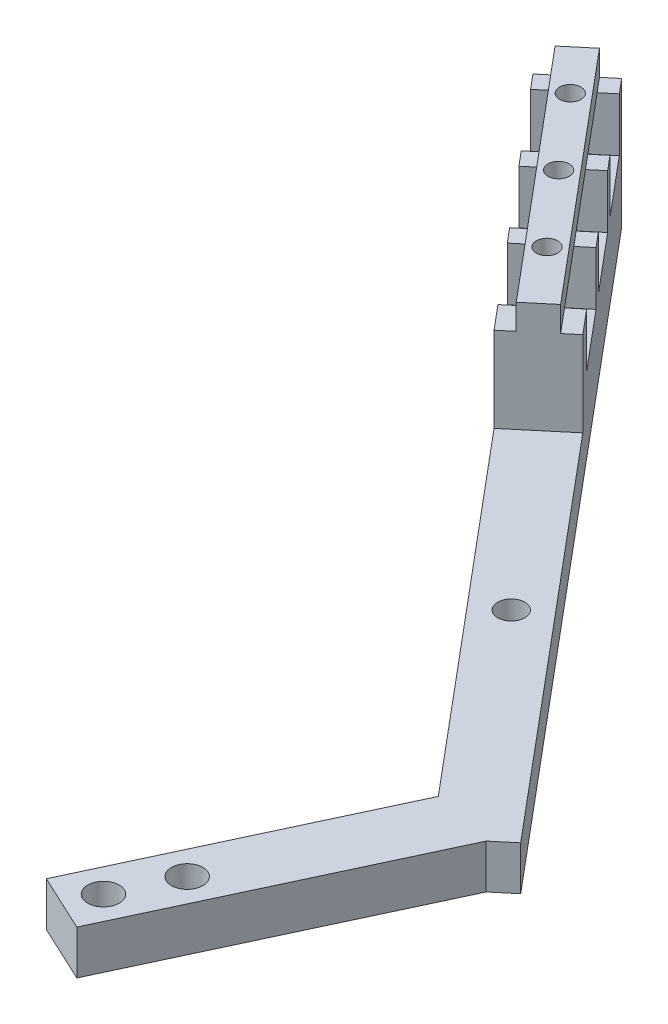
from build123d import *

# Parameters (mm, degrees)
SKETCH1_W           = 130
SKETCH1_H           = 10
SKETCH1_R           = 2.15
BOSS_EXTRUDE1_DEPTH = 7
SKETCH3_W           = 50
SKETCH3_H           = 10
BOSS_EXTRUDE2_DEPTH = 38.5
SKETCH9_W           = 10
SKETCH9_H           = 21
CUT_EXTRUDE5_DEPTH  = 139.095075944
SKETCH12_W          = 50
SKETCH12_H          = 4
CUT_EXTRUDE6_DEPTH  = 2.5
SKETCH13_W          = 50
SKETCH13_H          = 4
CUT_EXTRUDE7_DEPTH  = 2.5
SKETCH14_W          = 12
SKETCH14_H          = 8.5
CUT_EXTRUDE9_DEPTH  = 133.665933834
SKETCH15_R          = 1.7
CUT_EXTRUDE10_DEPTH = 132.98579469
BOSS_EXTRUDE4_DEPTH = 7
BOSS_EXTRUDE5_DEPTH = 7
SKETCH18_R          = 2.5
CUT_EXTRUDE11_DEPTH = 7
SKETCH19_R          = 2.5
CUT_EXTRUDE12_DEPTH = 7


with BuildPart() as part:
    # Sketch1 → Boss-Extrude1 (new body)
    with BuildSketch(Plane(origin=(0, 0, 0), x_dir=(1, 0, 0), z_dir=(0, 1, 0))):
        with Locations((65, -5)):
            Rectangle(SKETCH1_W, SKETCH1_H)
        with Locations((5, -5)):
            Circle(SKETCH1_R, mode=Mode.SUBTRACT)
        with Locations((45, -5)):
            Circle(SKETCH1_R, mode=Mode.SUBTRACT)
    extrude(amount=BOSS_EXTRUDE1_DEPTH)

    # Sketch3 → Boss-Extrude2 (add)
    with BuildSketch(Plane(origin=(0, 7, 0), x_dir=(1, 0, 0), z_dir=(0, 1, 0))):
        with Locations((105, -5)):
            Rectangle(SKETCH3_W, SKETCH3_H)
    extrude(amount=BOSS_EXTRUDE2_DEPTH)

    # Sketch9 → Cut-Extrude5 (cut, through all)
    with BuildSketch(Plane(origin=(130, 0, 0), x_dir=(0, 0, -1), z_dir=(1, 0, 0))):
        with Locations((-5, 35)):
            Rectangle(SKETCH9_W, SKETCH9_H)
    extrude(amount=-CUT_EXTRUDE5_DEPTH, mode=Mode.SUBTRACT)

    # Sketch12 → Cut-Extrude6 (cut)
    with BuildSketch(Plane.XY.offset(10)):
        with Locations((105, 22.5)):
            Rectangle(SKETCH12_W, SKETCH12_H)
    extrude(amount=-CUT_EXTRUDE6_DEPTH, mode=Mode.SUBTRACT)

    # Sketch13 → Cut-Extrude7 (cut)
    with BuildSketch(Plane(origin=(0, 0, 0), x_dir=(-1, 0, 0), z_dir=(0, 0, -1))):
        with Locations((-105, 22.5)):
            Rectangle(SKETCH13_W, SKETCH13_H)
    extrude(amount=-CUT_EXTRUDE7_DEPTH, mode=Mode.SUBTRACT)

    # Sketch14 → Cut-Extrude9 (cut, through all)
    with BuildSketch(Plane.XY.offset(10)):
        with Locations((121, 16.25)):
            Rectangle(SKETCH14_W, SKETCH14_H)
        with Locations((91, 16.25)):
            Rectangle(SKETCH14_W, SKETCH14_H)
        with Locations((106, 16.25)):
            Rectangle(SKETCH14_W, SKETCH14_H)
    extrude(amount=-CUT_EXTRUDE9_DEPTH, mode=Mode.SUBTRACT)

    # Sketch15 → Cut-Extrude10 (cut, through all)
    with BuildSketch(Plane(origin=(0, 20.5, 0), x_dir=(-1, 0, 0), z_dir=(0, -1, 0))):
        with Locations((-121, -5)):
            Circle(SKETCH15_R)
        with Locations((-106, -5)):
            Circle(SKETCH15_R)
        with Locations((-91, -5)):
            Circle(SKETCH15_R)
    extrude(amount=-CUT_EXTRUDE10_DEPTH, mode=Mode.SUBTRACT)

    # Sketch16 → Boss-Extrude4 (add)
    with BuildSketch(Plane(origin=(0, 0, 0), x_dir=(-1, 0, 0), z_dir=(0, -1, 0))):
        Polygon((-1.50258434, -7.646823985), (-0.468461065, -2.886908691), (-6.753211413, -1.521504853), (-7.787334687, -6.281420147), align=None)
        Polygon((0, -10), (-8.185351304, -10), (11.599374152, -52.428480661), (20.662452022, -48.202298043), (0, -3.891526687), align=None)
    extrude(amount=-BOSS_EXTRUDE4_DEPTH)

    # Sketch17 → Boss-Extrude5 (add)
    with BuildSketch(Plane.XZ):
        Polygon((2.4610909, 5.994926227), (7.864957682, 4.358157031), (8.790682018, 7.414477373), (3.386815236, 9.051246569), align=None)
    extrude(amount=-BOSS_EXTRUDE5_DEPTH)

    # Sketch18 → Cut-Extrude11 (cut)
    with BuildSketch(Plane(origin=(0, 0, 0), x_dir=(-1, 0, 0), z_dir=(0, -1, 0))):
        with Locations((14.017821778, -45.783850417)):
            Circle(SKETCH18_R)
    extrude(amount=-CUT_EXTRUDE11_DEPTH, mode=Mode.SUBTRACT)

    # Sketch19 → Cut-Extrude12 (cut)
    with BuildSketch(Plane(origin=(0, 0, 0), x_dir=(-1, 0, 0), z_dir=(0, -1, 0))):
        with Locations((9.791639161, -36.720772546)):
            Circle(SKETCH19_R)
    extrude(amount=-CUT_EXTRUDE12_DEPTH, mode=Mode.SUBTRACT)


with BuildPart() as body_2:
    # Mirror3: mirrored copy
    add(part.part.mirror(Plane(origin=(1.490541197, 7, 0.695050775), x_dir=(-0.422618261740704, 0, 0.9063077870366478), z_dir=(-0.9063077870366479, 0, -0.422618261740704))))


solid = body_2.part
